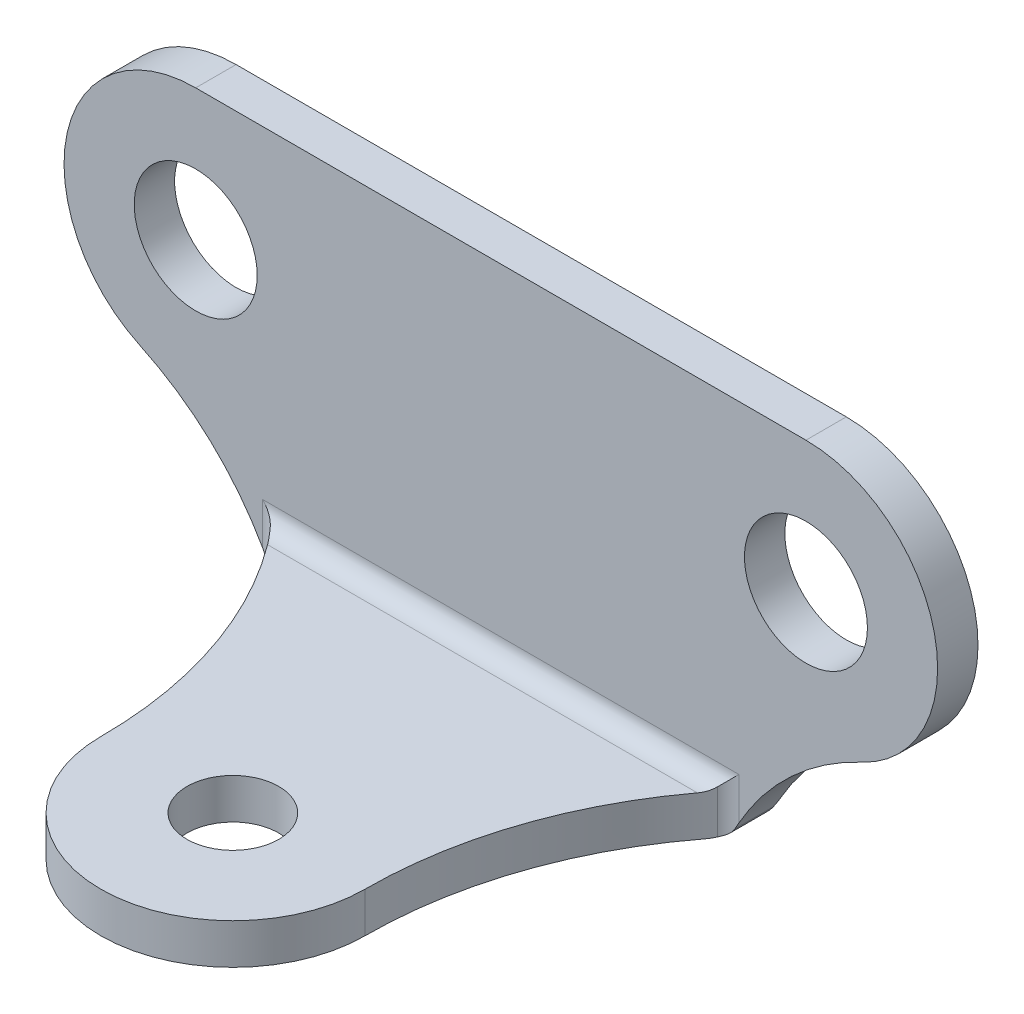
from build123d import *

# Parameters (mm, degrees)
ESBO_O1_R                  = 3.35
RESSALTO_EXTRUS_O1_DEPTH   = 2.2
ESBO_O2_W                  = 25
ESBO_O2_H                  = 2.2
RESSALTO_EXTRUS_O2_DEPTH   = 21.8
CORTE_EXTRUS_O2_DEPTH      = 40.687277558
CORTE_EXTRUS_O2_DEPTH_BACK = 24
ESBO_O3_R                  = 2.5
FILETE1_R                  = 1


with BuildPart() as part:
    # Esboço1 → Ressalto-extrusão1 (new body)
    with BuildSketch(Plane.XY):
        with BuildLine():
            ThreePointArc((19.671946284, -6.495902042), (15.467093732, -9.437851933), (12.5, -13.625))
            Line((12.5, -13.625), (-12.5, -13.625))
            ThreePointArc((-12.5, -13.625), (-15.467093732, -9.437851933), (-19.671946284, -6.495902042))
            ThreePointArc((-19.671946284, -6.495902042), (-23.628167932, 1.560853588), (-16.625, 7.175))
            Line((-16.625, 7.175), (16.625, 7.175))
            ThreePointArc((16.625, 7.175), (23.628167932, 1.560853588), (19.671946284, -6.495902042))
        make_face()
        with Locations((16.625, 0)):
            Circle(ESBO_O1_R, mode=Mode.SUBTRACT)
        with Locations((-16.625, 0)):
            Circle(ESBO_O1_R, mode=Mode.SUBTRACT)
    extrude(amount=RESSALTO_EXTRUS_O1_DEPTH)

    # Esboço2 → Ressalto-extrusão2 (add)
    with BuildSketch(Plane.XY.offset(2.2)):
        with Locations((0, -12.525)):
            Rectangle(ESBO_O2_W, ESBO_O2_H)
    extrude(amount=RESSALTO_EXTRUS_O2_DEPTH)

    # Esboço3 → Corte-extrusão2 (cut, two sides: drawn at the far end of the back side and taken through both)
    with BuildSketch(Plane.XZ.offset(13.625).offset(-CORTE_EXTRUS_O2_DEPTH_BACK)):
        with Locations(Location((0, 16.8, 0), (0, 0, 90))):
            Circle(ESBO_O3_R)
        with BuildLine():
            ThreePointArc((-12.5, 2.2), (-8.565992578, 9.033887716), (-7.2, 16.8))
            ThreePointArc((-7.2, 16.8), (-5.091168815, 21.891168834), (2.7e-08, 24))
            Line((2.7e-08, 24), (-12.5, 24))
            Line((-12.5, 24), (-12.5, 2.2))
        make_face()
        with BuildLine():
            Line((12.5, 24), (2.7e-08, 24))
            ThreePointArc((2.7e-08, 24), (5.091168834, 21.891168815), (7.2, 16.8))
            ThreePointArc((7.2, 16.8), (8.565992578, 9.033887716), (12.5, 2.2))
            Line((12.5, 2.2), (12.5, 24))
        make_face()
    extrude(amount=CORTE_EXTRUS_O2_DEPTH + CORTE_EXTRUS_O2_DEPTH_BACK, mode=Mode.SUBTRACT)

    # Filete1
    filete1_edges = [part.edges().sort_by_distance(p)[0] for p in [
        (12.5, -12.525, 2.2),
        (-12.5, -12.525, 2.2),
        (0, -11.425, 2.2),
    ]]
    fillet(filete1_edges, radius=FILETE1_R)
    filete1_2_edges = [part.edges().sort_by_distance(p)[0] for p in [
        (0, -13.625, 0),
        (12.5, -13.625, 1.159674218),
        (-12.5, -13.625, 1.159674218),
    ]]
    fillet(filete1_2_edges, radius=FILETE1_R)


solid = part.part
